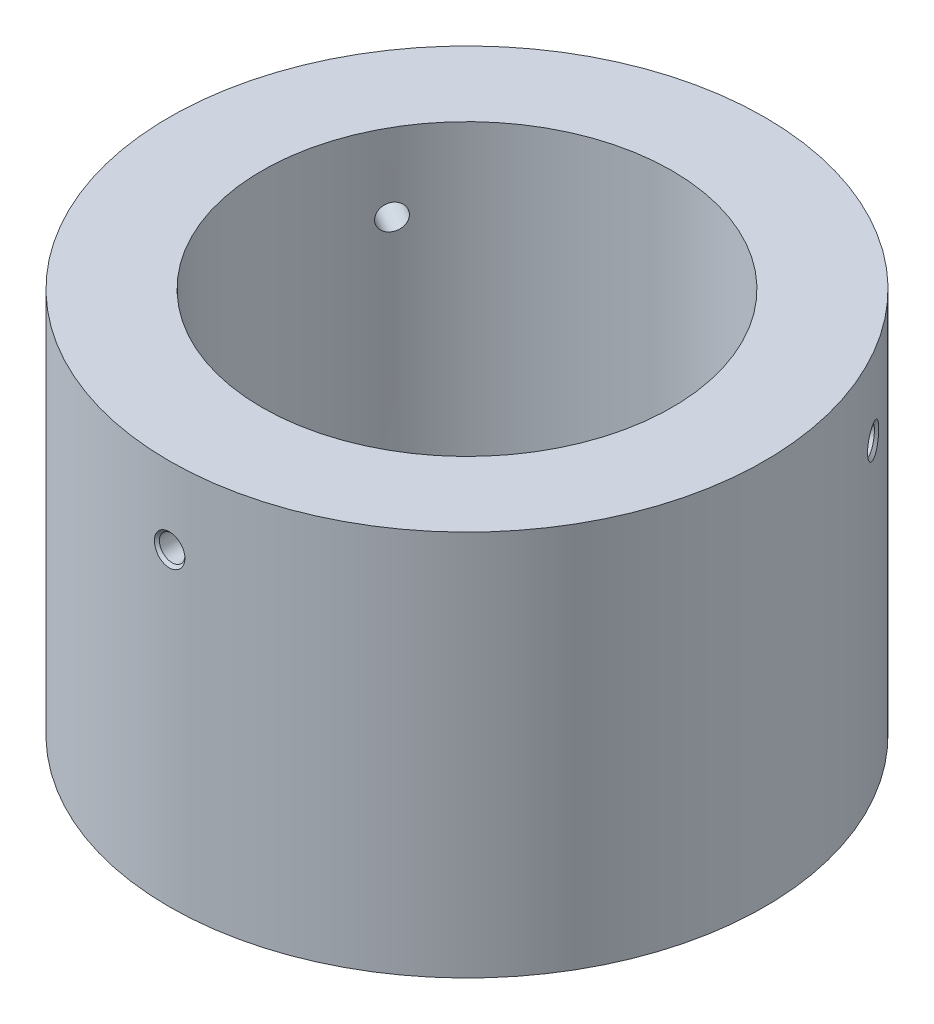
from build123d import *

# Parameters (mm, degrees)
ESQUISSE1_R                     = 38.550000000000004
ESQUISSE1_R_2                   = 26.55
BOSS_EXTRU_1_DEPTH              = 50
TROU_TARAUD_M4X0_71_D           = 3.3
TROU_TARAUD_M4X0_71_DEPTH       = 16
TROU_TARAUD_M4X0_71_CSINK_D     = 4.05
TROU_TARAUD_M4X0_71_CSINK_ANGLE = 90
TROU_TARAUD_M4X0_71_TIP         = 0.9914200213954745


# Read off the part's stored shape, not the designer's step: Trou taraudé M4x0.74
with BuildPart() as part:
    # Esquisse1 → Boss.-Extru.1 (new body)
    with BuildSketch(Plane(origin=(0, 0, 0), x_dir=(1, 0, 0), z_dir=(0, 1, 0))):
        with Locations(Location((0, 0, 0), (0, 0, 270))):
            Circle(ESQUISSE1_R)
        with Locations(Location((0, 0, 0), (0, 0, 270))):
            Circle(ESQUISSE1_R_2, mode=Mode.SUBTRACT)
    extrude(amount=BOSS_EXTRU_1_DEPTH)

    # Trou taraudé M4x0.71
    with Locations(Plane(origin=(0, 0, 0), x_dir=(-1, 0, 0), z_dir=(0, -1, 0))):
        with Locations((-23.016325728, -23.016325728), (-23.016325728, 23.016325728), (23.016325728, 23.016325728), (23.016325728, -23.016325728)):
            CounterSinkHole(TROU_TARAUD_M4X0_71_D / 2, TROU_TARAUD_M4X0_71_CSINK_D / 2, depth=TROU_TARAUD_M4X0_71_DEPTH, counter_sink_angle=TROU_TARAUD_M4X0_71_CSINK_ANGLE)
            with Locations((0, 0, -(TROU_TARAUD_M4X0_71_DEPTH + TROU_TARAUD_M4X0_71_TIP / 2))):  # 118° drill point
                Cone(0, TROU_TARAUD_M4X0_71_D / 2, TROU_TARAUD_M4X0_71_TIP, mode=Mode.SUBTRACT)

    # Trou taraudé M4x0.74 outline → Trou taraudé M4x0.74 (revolve, cut)
    with BuildSketch(Plane(origin=(0, 39.944411858, 0), x_dir=(0.4998061049474771, 0, -0.8661373202080785), z_dir=(0, -1, 0))):
        Polygon((0, -38.55002295), (2.02502295, -38.55002295), (1.65, -38.175), (1.65, -26.498651577), (0, -26.498651577), align=None)
    revolve(axis=Axis((0, 39.944411858, 0), (0.8661373202080785, 0, 0.4998061049474771)), mode=Mode.SUBTRACT)

    # Trou taraud_ M4x0.74 2 outline → Trou taraud_ M4x0.74 2 (revolve, cut)
    with BuildSketch(Plane(origin=(0, 40.055300006, 0), x_dir=(0.49980598723152586, 0, 0.8661373881362702), z_dir=(0, 1.0000000000000002, 0))):
        Polygon((2.025014074, 38.550014074), (0, 38.550014074), (0, 26.498651577), (1.65, 26.498651577), (1.65, 38.175), align=None)
    revolve(axis=Axis((0, 40.055300006, 0), (0.8661373881362704, 0, -0.49980598723152597)), mode=Mode.SUBTRACT)

    # Trou taraud_ M4x0.74 3 outline → Trou taraud_ M4x0.74 3 (revolve, cut)
    with BuildSketch(Plane(origin=(0, 40.043688013, 0), x_dir=(0.9999999999344692, 0, 1.1448216284808903e-05), z_dir=(0, 1, 0))):
        Polygon((0, -38.549999963), (2.024999963, -38.549999963), (1.65, -38.175), (1.65, -26.498658226), (0, -26.498658226), align=None)
    revolve(axis=Axis((0, 40.043688013, 0), (1.1448216284808903e-05, 0, -0.9999999999344692)), mode=Mode.SUBTRACT)


solid = part.part
